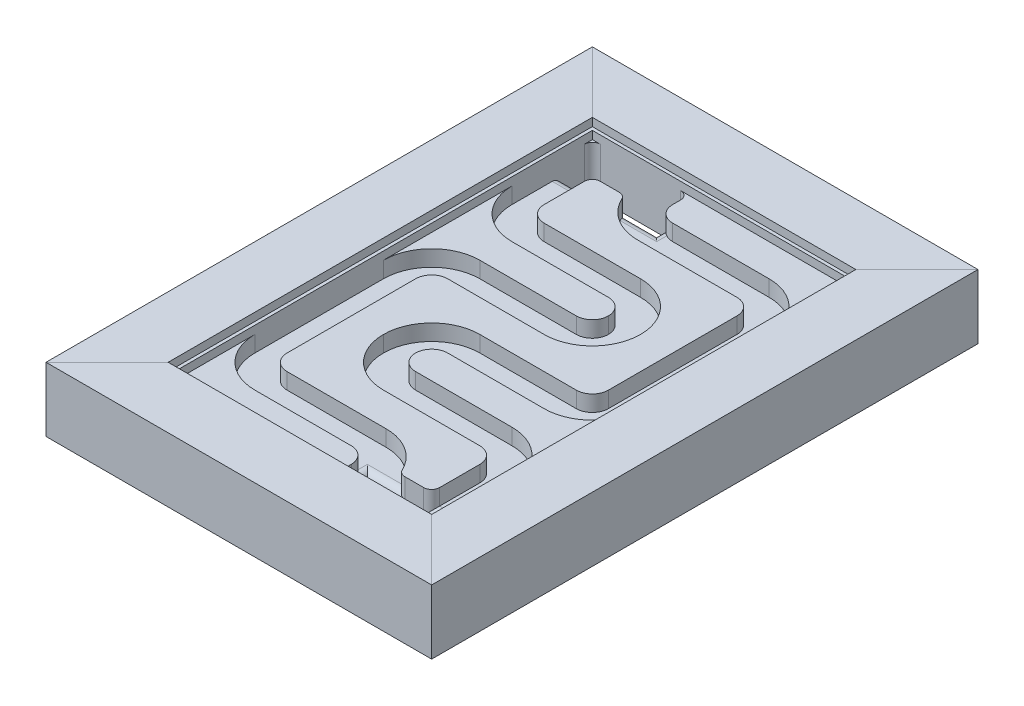
from build123d import *

# Parameters (mm, degrees)
SKIZZE1_W                            = 12
SKIZZE1_H                            = 17
AUFSATZ_LINEAR_AUSTRAGEN1_DEPTH      = 2
SCHNITT_LINEAR_AUSTRAGEN1_DEPTH      = 21.90454496
SCHNITT_LINEAR_AUSTRAGEN1_DEPTH_BACK = 21.90454496
SKIZZE4_W                            = 3
SKIZZE4_H                            = 1
SCHNITT_LINEAR_AUSTRAGEN3_DEPTH      = 1
VERRUNDUNG1_R                        = 0.5
VERRUNDUNG2_R                        = 1.5
VERRUNDUNG3_R                        = 0.25
SKIZZE2_W                            = 8
SKIZZE2_H                            = 13
SCHNITT_LINEAR_AUSTRAGEN4_DEPTH      = 0.5
SKIZZE6_W                            = 8.2
SKIZZE6_H                            = 13.2
SKIZZE6_W_2                          = 8
SKIZZE6_H_2                          = 13
SCHNITT_LINEAR_AUSTRAGEN5_DEPTH      = 0.25
SCHNITT_LINEAR_AUSTRAGEN6_DEPTH      = 21.90454496
AUFSATZ_LINEAR_AUSTRAGEN2_DEPTH      = 2
AUFSATZ_LINEAR_AUSTRAGEN2_2_DEPTH    = 2


# Some blends are built 0.0001 mm under size
with BuildPart() as part:
    # Skizze1 → Aufsatz-Linear austragen1 (new body)
    with BuildSketch(Plane(origin=(0, 0, 0), x_dir=(1, 0, 0), z_dir=(0, 1, 0))):
        with Locations((6, 8.5)):
            Rectangle(SKIZZE1_W, SKIZZE1_H)
    extrude(amount=AUFSATZ_LINEAR_AUSTRAGEN1_DEPTH)

    # Skizze4 → Schnitt-Linear austragen1 (cut, two sides: drawn at the far end of the back side and taken through both)
    with BuildSketch(Plane(origin=(0, 2, 0), x_dir=(1, 0, 0), z_dir=(0, 1, 0)).offset(-SCHNITT_LINEAR_AUSTRAGEN1_DEPTH_BACK)):
        with Locations((8.5, 2.5)):
            Rectangle(SKIZZE4_W, SKIZZE4_H)
        with Locations((3.5, 14.5)):
            Rectangle(SKIZZE4_W, SKIZZE4_H)
    extrude(amount=SCHNITT_LINEAR_AUSTRAGEN1_DEPTH + SCHNITT_LINEAR_AUSTRAGEN1_DEPTH_BACK, mode=Mode.SUBTRACT)

    # Skizze3 → Schnitt-Linear austragen3 (cut)
    with BuildSketch(Plane(origin=(0, 2, 0), x_dir=(1, 0, 0), z_dir=(0, 1, 0))):
        Polygon((8, 4), (3, 4), (3, 9), (8, 9), (8, 12), (3, 12), (3, 14), (2, 14), (2, 11), (7, 11), (7, 10), (2, 10), (2, 3), (8, 3), align=None)
        Polygon((9, 5), (4, 5), (4, 8), (9, 8), (9, 13), (4, 13), (4, 14), (10, 14), (10, 7), (5, 7), (5, 6), (10, 6), (10, 3), (9, 3), align=None)
    extrude(amount=-SCHNITT_LINEAR_AUSTRAGEN3_DEPTH, mode=Mode.SUBTRACT)

    # Verrundung1
    verrundung1_edges = [part.edges().sort_by_distance(p)[0] for p in [
        (3, 1.5, -12),
        (3, 1.5, -9),
        (7, 1.5, -3),
        (5, 1.5, -14),
        (9, 1.5, -5),
        (9, 1.5, -8),
        (9, 1.5, -13),
        (5, 1.5, -7),
        (5, 1.5, -6),
        (3, 1.5, -4),
        (7, 1.5, -10),
        (7, 1.5, -11),
    ]]
    fillet(verrundung1_edges, radius=VERRUNDUNG1_R - 0.0001)  # a hair under: the kernel refuses the full size

    # Verrundung2
    # the kernel refuses this fillet: 1.5 mm, written as the material it adds along each edge
    with BuildSketch(Plane(origin=(4, 2, -8), x_dir=(0, 0, 1), z_dir=(0, -1, 0)), Plane(origin=(2, 2, -11), x_dir=(1, 0, 0), z_dir=(0, -1, 0)), Plane(origin=(2, 2, -3), x_dir=(1, 0, 0), z_dir=(0, -1, 0)), Plane(origin=(2, 2, -10), x_dir=(0, 0, 1), z_dir=(0, -1, 0)), Plane(origin=(4, 2, -5), x_dir=(1, 0, 0), z_dir=(0, -1, 0))) as verrundung2_piece_1:
        with BuildLine():
            CenterArc((VERRUNDUNG2_R, -VERRUNDUNG2_R), VERRUNDUNG2_R, 90, 90)
            Line((0, -VERRUNDUNG2_R), (-VERRUNDUNG2_R * 0.02, -VERRUNDUNG2_R))
            Line((-VERRUNDUNG2_R * 0.02, -VERRUNDUNG2_R), (-VERRUNDUNG2_R * 0.02, VERRUNDUNG2_R * 0.02))
            Line((-VERRUNDUNG2_R * 0.02, VERRUNDUNG2_R * 0.02), (VERRUNDUNG2_R, VERRUNDUNG2_R * 0.02))
            Line((VERRUNDUNG2_R, VERRUNDUNG2_R * 0.02), (VERRUNDUNG2_R, 0))
        make_face()
    extrude(amount=1)
    with BuildSketch(Plane(origin=(8, 2, -4), x_dir=(-1, 0, 0), z_dir=(0, -1, 0)), Plane(origin=(4, 2, -13), x_dir=(1, 0, 0), z_dir=(0, -1, 0))) as verrundung2_piece_2:
        with BuildLine():
            CenterArc((1.414213562, -1.5), VERRUNDUNG2_R, 90, 70.528779366)
            Line((0, -1), (-0.028284271, -0.99))
            ThreePointArc((-0.028284271, -0.99), (-0.03, -0.5), (-0.03, 0))
            Line((-0.03, 0), (0, 0.03))
            Line((0, 0.03), (1.414213562, 0.03))
            Line((1.414213562, 0.03), (1.414213562, 0))
        make_face()
    extrude(amount=1)
    with BuildSketch(Plane(origin=(10, 2, -14), x_dir=(0, 0, 1), z_dir=(0, -1, 0)), Plane(origin=(10, 2, -7), x_dir=(-1, 0, 0), z_dir=(0, -1, 0)), Plane(origin=(10, 2, -6), x_dir=(0, 0, 1), z_dir=(0, -1, 0)), Plane(origin=(8, 2, -12), x_dir=(0, 0, 1), z_dir=(0, -1, 0)), Plane(origin=(8, 2, -9), x_dir=(-1, 0, 0), z_dir=(0, -1, 0))) as verrundung2_piece_3:
        with BuildLine():
            CenterArc((VERRUNDUNG2_R, VERRUNDUNG2_R), VERRUNDUNG2_R, 180, 90)
            Line((0, VERRUNDUNG2_R), (-VERRUNDUNG2_R * 0.02, VERRUNDUNG2_R))
            Line((-VERRUNDUNG2_R * 0.02, VERRUNDUNG2_R), (-VERRUNDUNG2_R * 0.02, -VERRUNDUNG2_R * 0.02))
            Line((-VERRUNDUNG2_R * 0.02, -VERRUNDUNG2_R * 0.02), (VERRUNDUNG2_R, -VERRUNDUNG2_R * 0.02))
            Line((VERRUNDUNG2_R, -VERRUNDUNG2_R * 0.02), (VERRUNDUNG2_R, 0))
        make_face()
    extrude(amount=1)

    # Verrundung3
    verrundung3_edges = [part.edges().sort_by_distance(p)[0] for p in [
        (3, 1.5, -14),
        (2.5, 1, -14),
        (5, 1, -14.24995),
        (7, 1, -2.75005),
        (10, 1, -2),
        (7, 1, -2),
        (2, 1, -15),
        (5, 1, -15),
        (4, 1.5, -14),
        (9, 1.5, -3),
        (4.5, 1, -14),
        (9.5, 1, -3),
        (7.5, 1, -3),
        (8, 1.5, -3),
    ]]
    fillet(verrundung3_edges, radius=VERRUNDUNG3_R)

    # Skizze2 → Schnitt-Linear austragen4 (cut)
    with BuildSketch(Plane(origin=(0, 2, 0), x_dir=(1, 0, 0), z_dir=(0, 1, 0))):
        with Locations((6, 8.5)):
            Rectangle(SKIZZE2_W, SKIZZE2_H)
    extrude(amount=-SCHNITT_LINEAR_AUSTRAGEN4_DEPTH, mode=Mode.SUBTRACT)

    # Skizze6 → Schnitt-Linear austragen5 (cut)
    with BuildSketch(Plane(origin=(0, 2, 0), x_dir=(1, 0, 0), z_dir=(0, 1, 0))):
        with Locations((6, 8.5)):
            Rectangle(SKIZZE6_W, SKIZZE6_H)
        with Locations((6, 8.5)):
            Rectangle(SKIZZE6_W_2, SKIZZE6_H_2, mode=Mode.SUBTRACT)
    extrude(amount=-SCHNITT_LINEAR_AUSTRAGEN5_DEPTH, mode=Mode.SUBTRACT)

    # Skizze7 → Schnitt-Linear austragen6 (cut, through all)
    with BuildSketch(Plane(origin=(0, 2, 0), x_dir=(1, 0, 0), z_dir=(0, 1, 0))):
        Polygon((1.9, 15.1), (0, 17), (0, 0), (1.9, 1.9), align=None)
        Polygon((10.1, 15.1), (12, 17), (12, 0), (10.1, 1.9), align=None)
    extrude(amount=-SCHNITT_LINEAR_AUSTRAGEN6_DEPTH, mode=Mode.SUBTRACT)


with BuildPart() as body_2:
    # Skizze8 → Aufsatz-Linear austragen2 (new body)
    with BuildSketch(Plane(origin=(0, 2, 0), x_dir=(1, 0, 0), z_dir=(0, 1, 0))):
        Polygon((0, 17), (0, 0), (1.9, 1.9), (1.9, 15.1), align=None)
    extrude(amount=-AUFSATZ_LINEAR_AUSTRAGEN2_DEPTH)


with BuildPart() as body_3:
    # Skizze8 → Aufsatz-Linear austragen2 2 (new body)
    with BuildSketch(Plane(origin=(0, 2, 0), x_dir=(1, 0, 0), z_dir=(0, 1, 0))):
        Polygon((10.1, 15.1), (10.1, 1.9), (12, 0), (12, 17), align=None)
    extrude(amount=-AUFSATZ_LINEAR_AUSTRAGEN2_2_DEPTH)


solid = Compound([part.part, body_2.part, body_3.part])
